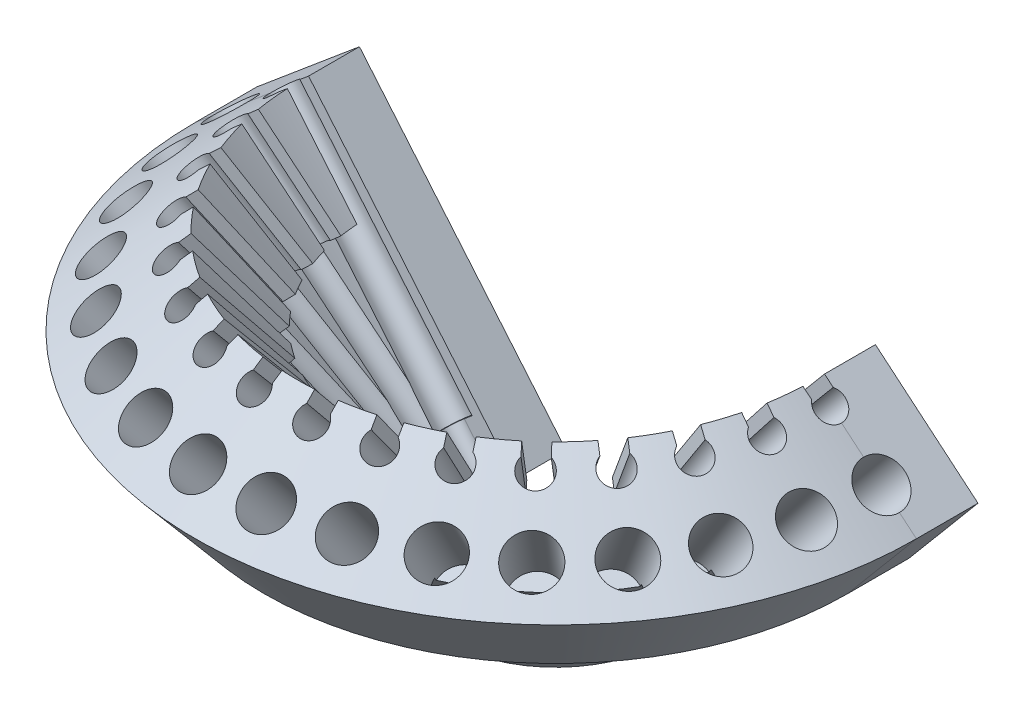
from build123d import *

# Parameters (mm, degrees)
REVOLVE1_ANGLE      = 180
BOSS_EXTRUDE1_DEPTH = 2.3
SKETCH3_R           = 0.55
CUT_EXTRUDE1_DEPTH  = 10
CUT_EXTRUDE2_DEPTH  = 29.956882142
SKETCH3_3_R         = 0.875
CUT_EXTRUDE3_DEPTH  = 4.25
CIRPATTERN1_COUNT   = 16
CIRPATTERN1_ANGLE   = 180


# Read off the part's stored shape, not the designer's step: Revolve1, Boss-Extrude1
with BuildPart() as part:
    # Revolve1 outline → Revolve1 (revolve)
    with BuildSketch(Plane(origin=(0, 0, 0), x_dir=(-1, 0, 0), z_dir=(0, 0, -1))):
        Polygon((13.464335653, 8.267551252), (9.634113437, 11.4814893), (7.038004884, 8.387567605), (7.804049327, 7.744779995), (2.686706564, 1.646168373), (4.21879545, 0.360593153), (9.361096328, 6.488948698), (10.893185214, 5.203373479), align=None)
    revolve(axis=Axis((0, 0, 0), (0, 1, 0)), revolution_arc=REVOLVE1_ANGLE)

    # Boss-Extrude1 outline → Boss-Extrude1 (add)
    with BuildSketch(Plane(origin=(0, 0, 0), x_dir=(-1, 0, 0), z_dir=(0, 0, -1))):
        Polygon((-7.038004884, 8.387567605), (-9.634113437, 11.4814893), (-13.464335653, 8.267551252), (-10.893185214, 5.203373479), (-9.361096328, 6.488948698), (-4.21879545, 0.360593153), (-2.686706564, 1.646168373), (-7.804049327, 7.744779995), align=None)
        Polygon((9.634113437, 11.4814893), (1.920662121, 2.288955983), (4.21879545, 0.360593153), (9.361096328, 6.488948698), (10.893185214, 5.203373479), (13.464335653, 8.267551252), align=None)
    extrude(amount=BOSS_EXTRUDE1_DEPTH)

    # Sketch3 → Cut-Extrude1 (cut)
    with BuildSketch(Plane(origin=(-9.634113437, 11.4814893, 0), x_dir=(-0.7660444431189767, -0.6427876096865409, 0), z_dir=(-0.6427876096865409, 0.7660444431189767, 0))):
        with Locations(Location((0.8, 0, 0), (0, 0, 180.000000001))):
            Circle(SKETCH3_R)
    cut_extrude1 = extrude(amount=-CUT_EXTRUDE1_DEPTH, mode=Mode.SUBTRACT)

    # Sketch4 → Cut-Extrude2 (cut, through all)
    with BuildSketch(Plane(origin=(-9.634113437, 11.4814893, 0), x_dir=(-0.7660444431189767, -0.6427876096865409, 0), z_dir=(-0.6427876096865409, 0.7660444431189767, 0))):
        with BuildLine():
            Line((0.8, -0.4), (-1.645554628, -0.4))
            Line((-1.645554628, -0.4), (-1.645554628, 0.4))
            Line((-1.645554628, 0.4), (0.8, 0.4))
            ThreePointArc((0.8, 0.4), (1.2, 0), (0.8, -0.4))
        make_face()
    cut_extrude2 = extrude(amount=-CUT_EXTRUDE2_DEPTH, mode=Mode.SUBTRACT)

    # Sketch3<3> → Cut-Extrude3 (cut)
    with BuildSketch(Plane(origin=(-9.634113437, 11.4814893, 0), x_dir=(-0.7660444431189767, -0.6427876096865409, 0), z_dir=(-0.6427876096865409, 0.7660444431189767, 0))):
        with Locations((3.3, 0)):
            Circle(SKETCH3_3_R)
    cut_extrude3 = extrude(amount=-CUT_EXTRUDE3_DEPTH, mode=Mode.SUBTRACT)

    # CirPattern1: Cut-Extrude1, Cut-Extrude2, Cut-Extrude3 ×16 about axis
    cirpattern1_axis = Axis((0, 0, 0), (0, 1, 0))
    add([cut_extrude1.rotate(cirpattern1_axis, i * CIRPATTERN1_ANGLE / (CIRPATTERN1_COUNT - 1)) for i in range(1, CIRPATTERN1_COUNT)], mode=Mode.SUBTRACT)
    add([cut_extrude2.rotate(cirpattern1_axis, i * CIRPATTERN1_ANGLE / (CIRPATTERN1_COUNT - 1)) for i in range(1, CIRPATTERN1_COUNT)], mode=Mode.SUBTRACT)
    add([cut_extrude3.rotate(cirpattern1_axis, i * CIRPATTERN1_ANGLE / (CIRPATTERN1_COUNT - 1)) for i in range(1, CIRPATTERN1_COUNT)], mode=Mode.SUBTRACT)


solid = part.part
